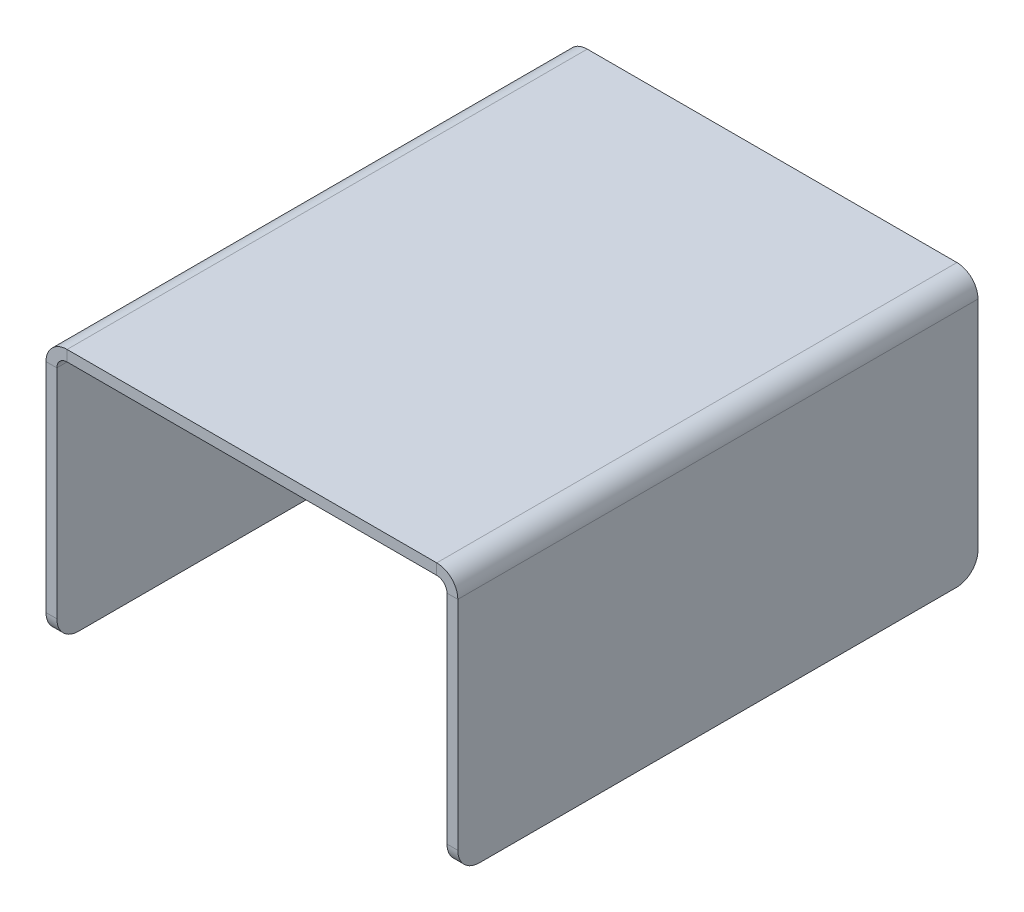
from build123d import *

# Parameters (mm, degrees)
SKETCH1_W                      = 114.3
SKETCH1_H                      = 152.4
BASE_FLANGE1_DEPTH             = 3.175
EDGE_FLANGE1_STRIP_W           = 18.700000192
EDGE_FLANGE1_STRIP_H           = 3.175
EDGE_FLANGE1_STRIP_CUT_DEPTH   = 152.4
EDGE_FLANGE1_STRIP_2_W         = 18.700000192
EDGE_FLANGE1_STRIP_2_H         = 3.175
EDGE_FLANGE1_STRIP_CUT_2_DEPTH = 152.4
EDGE_FLANGE1_DEPTH             = 152.4
EDGE_FLANGE1_BEND_DEPTH        = 152.4
FILLET1_R                      = 6.35


# Sheet-metal steps are written as plain solids
with BuildPart() as part:
    # Sketch1 → Base-Flange1 (new body)
    with BuildSketch(Plane(origin=(0, 0, 0), x_dir=(1, 0, 0), z_dir=(0, 1, 0))):
        Rectangle(SKETCH1_W, SKETCH1_H)
    extrude(amount=-BASE_FLANGE1_DEPTH)

    # Edge-Flange1 strip (across the edge) → Edge-Flange1 strip cut (cut)
    with BuildSketch(Plane(origin=(57.15, -3.175, -76.2), x_dir=(-1, 0, 0), z_dir=(0, 0, 1))):
        with Locations((-6.35, -1.5875)):
            Rectangle(EDGE_FLANGE1_STRIP_W, EDGE_FLANGE1_STRIP_H)
    extrude(amount=EDGE_FLANGE1_STRIP_CUT_DEPTH, mode=Mode.SUBTRACT)

    # Edge-Flange1 strip 2 (across the edge) → Edge-Flange1 strip cut 2 (cut)
    with BuildSketch(Plane(origin=(-57.15, -3.175, 76.2), x_dir=(1, 0, 0), z_dir=(0, 0, -1))):
        with Locations((-6.35, -1.5875)):
            Rectangle(EDGE_FLANGE1_STRIP_2_W, EDGE_FLANGE1_STRIP_2_H)
    extrude(amount=EDGE_FLANGE1_STRIP_CUT_2_DEPTH, mode=Mode.SUBTRACT)

    # Edge-Flange1 section (across the edge) → Edge-Flange1 (add)
    with BuildSketch(Plane(origin=(57.15, -3.175, -76.2), x_dir=(-1, 0, 0), z_dir=(0, 0, 1))):
        with BuildLine():
            Line((-3.175, 3.000000096), (-3.175, 73.025))
            Line((-3.175, 73.025), (0, 73.025))
            Line((0, 73.025), (0, 3.000000096))
            ThreePointArc((0, 3.000000096), (0.878679685, 0.878679685), (3.000000096, 0))
            Line((3.000000096, 0), (3.000000096, -3.175))
            ThreePointArc((3.000000096, -3.175), (-1.366384346, -1.366384346), (-3.175, 3.000000096))
        make_face()
    extrude(amount=EDGE_FLANGE1_DEPTH)

    # Edge-Flange1 section 2 (across the edge) → Edge-Flange1 bend (add)
    with BuildSketch(Plane(origin=(-57.15, -3.175, 76.2), x_dir=(1, 0, 0), z_dir=(0, 0, -1))):
        with BuildLine():
            Line((-3.175, 3.000000096), (-3.175, 73.025))
            Line((-3.175, 73.025), (0, 73.025))
            Line((0, 73.025), (0, 3.000000096))
            ThreePointArc((0, 3.000000096), (0.878679685, 0.878679685), (3.000000096, 0))
            Line((3.000000096, 0), (3.000000096, -3.175))
            ThreePointArc((3.000000096, -3.175), (-1.366384346, -1.366384346), (-3.175, 3.000000096))
        make_face()
    extrude(amount=EDGE_FLANGE1_BEND_DEPTH)

    # Fillet1
    fillet1_edges = [part.edges().sort_by_distance(p)[0] for p in [
        (58.7375, -76.2, -76.2),
        (58.7375, -76.2, 76.2),
        (-58.7375, -76.2, 76.2),
        (-58.7375, -76.2, -76.2),
    ]]
    fillet(fillet1_edges, radius=FILLET1_R)


solid = part.part
